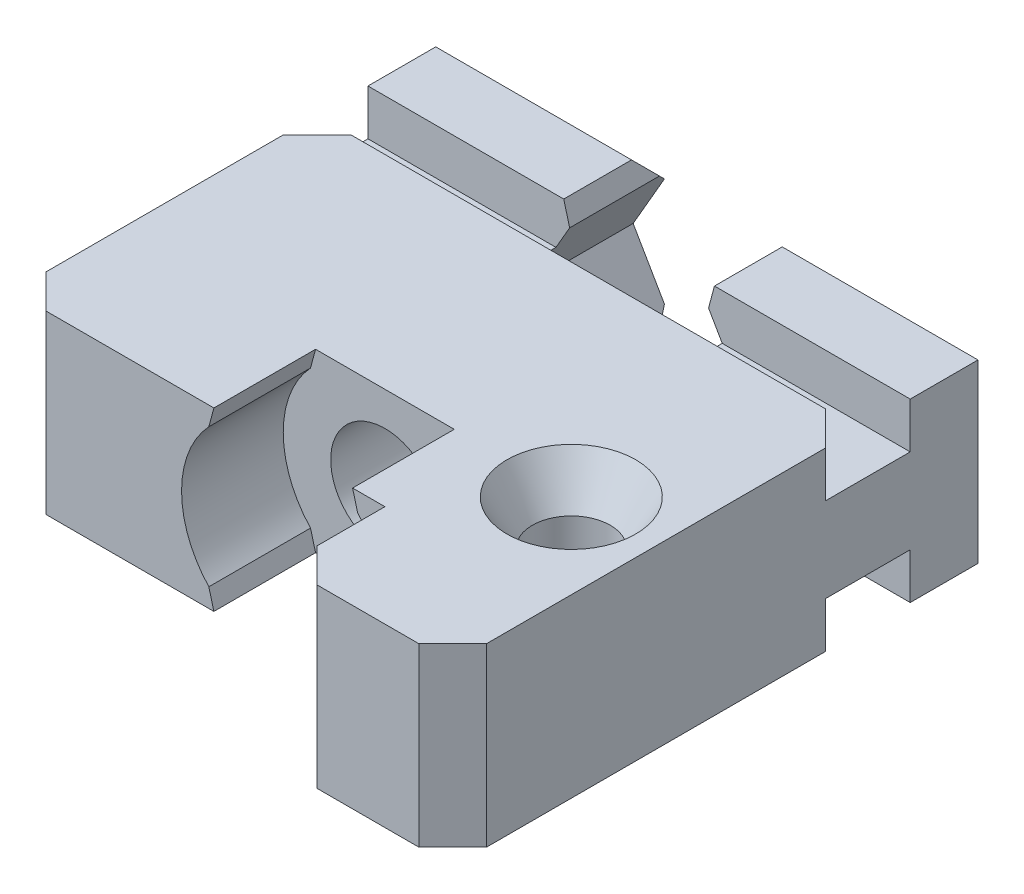
from build123d import *
from OCP.BRepFilletAPI import BRepFilletAPI_MakeChamfer

# Parameters (mm, degrees)
SKETCH1_R           = 1.15
BOSS_EXTRUDE1_DEPTH = 2.6
BOSS_EXTRUDE2_DEPTH = 16
SKETCH3_R           = 1.6
CUT_EXTRUDE1_DEPTH  = 24.13028318
SKETCH4_R           = 3
CUT_EXTRUDE2_DEPTH  = 3
CUT_EXTRUDE3_REACH  = 25.13
CHAMFER1_SIZE       = 0.549227511
CHAMFER1_SIZE_2     = 0.549038106
CHAMFER1_SIZE_3     = 0.75
CHAMFER2_SIZE       = 1
CHAMFER3_SIZE       = 0.75
CHAMFER3_SIZE2      = 1.299038106


with BuildPart() as part:
    # Sketch1 → Boss-Extrude1 (new, symmetric)
    with BuildSketch(Plane(origin=(0, 0, 0), x_dir=(1, 0, 0), z_dir=(0, 1, 0))):
        Polygon((0, 0), (16, 0), (16, -12), (11, -12), (11, -9), (0, -9), align=None)
        with Locations(Location((13.5, -6, 0), (0, 0, 270))):
            Circle(SKETCH1_R, mode=Mode.SUBTRACT)
    extrude(amount=BOSS_EXTRUDE1_DEPTH, both=True)

    # Sketch2 → Boss-Extrude2 (add)
    with BuildSketch(Plane.ZY):
        Polygon((-1.5, -1.25), (-1.5, -2.6), (-4.5, -2.6), (-4.5, 2.6), (-1.5, 2.6), (-1.5, 1.25), (0, 1.25), (0, -1.25), align=None)
    extrude(amount=-BOSS_EXTRUDE2_DEPTH)

    # Sketch3 → Cut-Extrude1 (cut, through all)
    with BuildSketch(Plane(origin=(0, 0, -4.5), x_dir=(-1, 0, 0), z_dir=(0, 0, -1))):
        with Locations((-8, 0)):
            Circle(SKETCH3_R)
    extrude(amount=-CUT_EXTRUDE1_DEPTH, mode=Mode.SUBTRACT)

    # Sketch4 → Cut-Extrude2 (cut)
    with BuildSketch(Plane.XY.offset(9)):
        with Locations((8, 0)):
            Circle(SKETCH4_R)
    extrude(amount=-CUT_EXTRUDE2_DEPTH, mode=Mode.SUBTRACT)

    # Cut-Extrude3: up to this face of the body (flat: up to its plane)
    cut_extrude3_end = Plane(part.part.faces().sort_by_distance((8, 1.937058452, 0))[0])
    # Sketch5 → Cut-Extrude3 (cut, up to the picked face)
    with BuildSketch(Plane(origin=(0, 0, -4.5), x_dir=(-1, 0, 0), z_dir=(0, 0, -1)), mode=Mode.PRIVATE) as cut_extrude3_sk1:
        Polygon((-4.824573519, 0), (-6.41228676, 2.75), (-9.58771324, 2.75), (-11.175426481, 0), (-9.58771324, -2.75), (-6.41228676, -2.75), align=None)
    cut_extrude3_tool1 = split(extrude(cut_extrude3_sk1.sketch, amount=-CUT_EXTRUDE3_REACH, mode=Mode.PRIVATE), bisect_by=cut_extrude3_end, keep=Keep.BOTH, mode=Mode.PRIVATE)
    add(cut_extrude3_tool1.solids().sort_by(Axis((8, 0, -4.5), (0, 0, 1)))[0], mode=Mode.SUBTRACT)

    # Chamfer1
    # the kernel refuses this chamfer: 0.75, 0.549227511, 0.549038106 mm, written as the material it takes off along each edge
    with BuildSketch(Plane(origin=(9.496662955, 2.6, 6), x_dir=(0.7827857508590854, -0.6222913049786071, 0), z_dir=(0, 0, 1)), Plane(origin=(6.503337045, -2.6, 6), x_dir=(-0.7827857508590857, 0.6222913049786067, 0), z_dir=(0, 0, 1))) as chamfer1_piece_1:
        with BuildLine():
            Line((0.892781916, 0), (CHAMFER1_SIZE * 0.782785751548, CHAMFER1_SIZE * 0.622291305526))
            Line((CHAMFER1_SIZE * 0.782785751548, CHAMFER1_SIZE * 0.622291305526), (0, 0))
            ThreePointArc((0, 0), (0.458630217, 0.033371738), (0.892781916, 0))
        make_face()
    extrude(amount=5.292721472, mode=Mode.SUBTRACT)
    with BuildSketch(Plane(origin=(9.496662955, -2.6, 6), x_dir=(0.7827857508590856, 0.6222913049786071, 0), z_dir=(0, 0, 1)), Plane(origin=(6.503337045, 2.6, 6), x_dir=(-0.7827857508590856, -0.622291304978607, 0), z_dir=(0, 0, 1))) as chamfer1_piece_2:
        with BuildLine():
            Line((0.892781916, 0), (CHAMFER1_SIZE * 0.782785751548, -CHAMFER1_SIZE * 0.622291305526))
            Line((CHAMFER1_SIZE * 0.782785751548, -CHAMFER1_SIZE * 0.622291305526), (0, 0))
            ThreePointArc((0, 0), (0.458630217, -0.033371738), (0.892781916, 0))
        make_face()
    extrude(amount=5.292721472, mode=Mode.SUBTRACT)
    with BuildSketch(Plane(origin=(6.325684219, -2.6, -6.428762241), x_dir=(-1, 0, 0), z_dir=(0, 0, 1)), Plane(origin=(9.674315781, -2.6, -1.5), x_dir=(1, 0, 0), z_dir=(0, 0, -1)), Plane(origin=(9.674315781, 2.6, -6.428762241), x_dir=(1, 0, 0), z_dir=(0, 0, 1)), Plane(origin=(6.325684219, 2.6, -1.5), x_dir=(-1, 0, 0), z_dir=(0, 0, -1))) as chamfer1_piece_3:
        Polygon((CHAMFER1_SIZE_2, 0), (CHAMFER1_SIZE_3 * 0.5, -CHAMFER1_SIZE_3 * 0.866025403784), (0, 0), align=None)
    extrude(amount=4.928762241, mode=Mode.SUBTRACT)

    # Chamfer2
    chamfer2_edges = [part.edges().sort_by_distance(p)[0] for p in [
        (16, 0, 12),
        (11, 0, 12),
        (0, 0, 9),
        (16, -1.925, 0),
        (16, 1.925, 0),
        (0, -1.925, 0),
        (0, 1.925, 0),
        (2.888323057, -2.6, -4.5),
        (0, 0, -4.5),
        (16, 0, -4.5),
        (2.888323057, 2.6, -4.5),
        (13.111676943, -2.6, -4.5),
        (13.111676943, 2.6, -4.5),
    ]]
    chamfer(chamfer2_edges, length=CHAMFER2_SIZE)

    # Chamfer3: one chamfer whose edges measure the first distance from different faces: ONE call of the kernel's chamfer builder (chamfer() names one face for all edges)
    chamfer3_edges_1 = [part.edges().sort_by_distance(p)[0] for p in [
        (13.5, -2.6, 4.85),
    ]]
    chamfer3_side_1 = [part.faces().sort_by_distance(p)[0] for p in [
        (8.413951701, -2.6, 4.798840105),
    ]]
    chamfer3_edges_2 = [part.edges().sort_by_distance(p)[0] for p in [
        (13.5, 2.6, 4.85),
    ]]
    chamfer3_side_2 = [part.faces().sort_by_distance(p)[0] for p in [
        (8.413951701, 2.6, 4.798840105),
    ]]
    chamfer3 = BRepFilletAPI_MakeChamfer(part.part.solid().wrapped)
    for e in chamfer3_edges_1:
        chamfer3.Add(CHAMFER3_SIZE, CHAMFER3_SIZE2, e.wrapped, chamfer3_side_1[0].wrapped)  # the first distance lies on this face
    for e in chamfer3_edges_2:
        chamfer3.Add(CHAMFER3_SIZE, CHAMFER3_SIZE2, e.wrapped, chamfer3_side_2[0].wrapped)  # the first distance lies on this face
    add(Compound.cast(chamfer3.Shape()), mode=Mode.REPLACE)


solid = part.part
